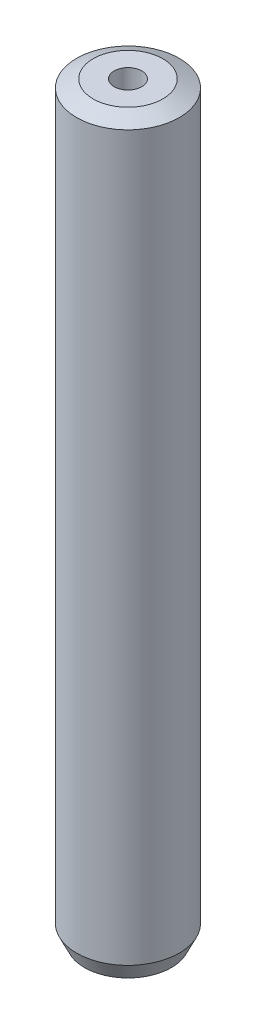
from build123d import *
from OCP.BRepFilletAPI import BRepFilletAPI_MakeChamfer

# Parameters (mm, degrees)
SKETCH1_R           = 12.5
BOSS_EXTRUDE1_DEPTH = 182.03953716
SKETCH2_R           = 3.352969084
CUT_EXTRUDE1_DEPTH  = 183.895853123
CHAMFER1_SIZE       = 1.92178498
CHAMFER1_SIZE2      = 4.02044663


with BuildPart() as part:
    # Sketch1 → Boss-Extrude1 (new body)
    with BuildSketch(Plane(origin=(0, 0, 0), x_dir=(1, 0, 0), z_dir=(0, 1, 0))):
        Circle(SKETCH1_R)
    extrude(amount=BOSS_EXTRUDE1_DEPTH)

    # Sketch2 → Cut-Extrude1 (cut, through all)
    with BuildSketch(Plane(origin=(0, 0, 0), x_dir=(1, 0, 0), z_dir=(0, 1, 0))):
        Circle(SKETCH2_R)
    extrude(amount=CUT_EXTRUDE1_DEPTH, mode=Mode.SUBTRACT)

    # Chamfer1: one chamfer whose edges measure the first distance from different faces: ONE call of the kernel's chamfer builder (chamfer() names one face for all edges)
    chamfer1_edges_1 = [part.edges().sort_by_distance(p)[0] for p in [
        (-12.5, 182.03953716, 0),
    ]]
    chamfer1_side_1 = [part.faces().sort_by_distance(p)[0] for p in [
        (-12.5, 91.01976858, 0),
    ]]
    chamfer1_edges_2 = [part.edges().sort_by_distance(p)[0] for p in [
        (-12.5, 0, 0),
    ]]
    chamfer1_side_2 = [part.faces().sort_by_distance(p)[0] for p in [
        (-12.146446609, 0, 0),
    ]]
    chamfer1 = BRepFilletAPI_MakeChamfer(part.part.solid().wrapped)
    for e in chamfer1_edges_1:
        chamfer1.Add(CHAMFER1_SIZE, CHAMFER1_SIZE2, e.wrapped, chamfer1_side_1[0].wrapped)  # the first distance lies on this face
    for e in chamfer1_edges_2:
        chamfer1.Add(CHAMFER1_SIZE, CHAMFER1_SIZE2, e.wrapped, chamfer1_side_2[0].wrapped)  # the first distance lies on this face
    add(Compound.cast(chamfer1.Shape()), mode=Mode.REPLACE)


solid = part.part
